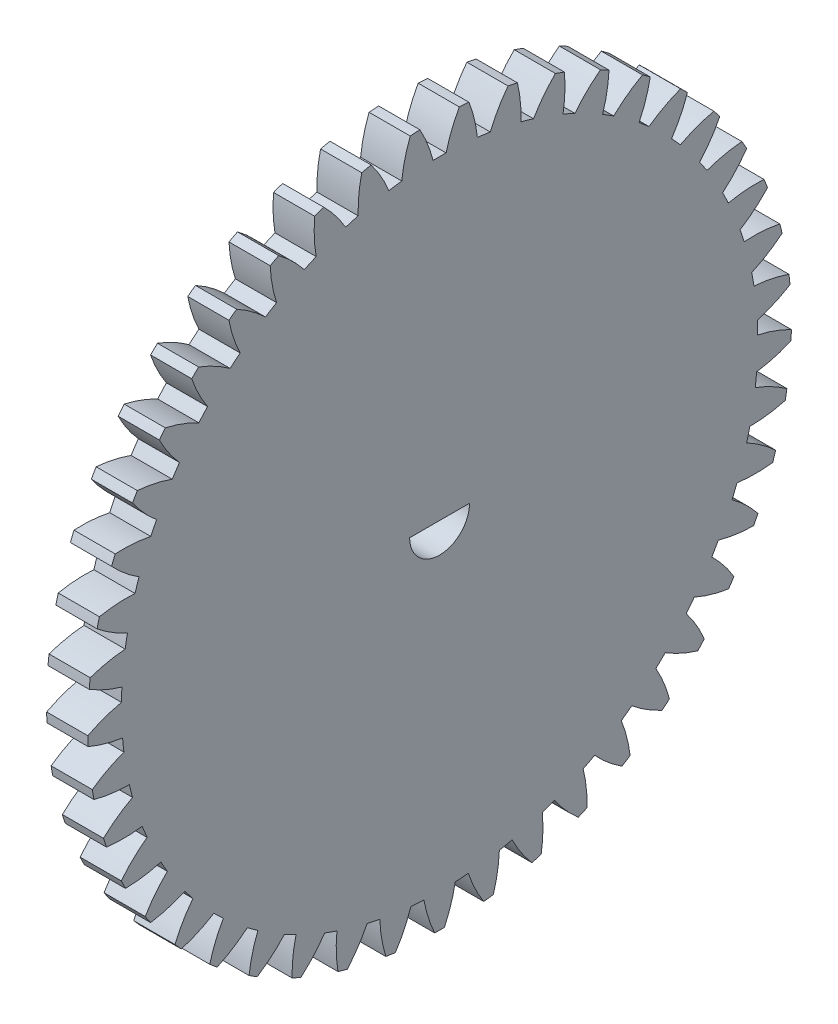
from build123d import *

# Parameters (mm, degrees)
BASPROSKE_W           = 5.5
BASPROSKE_H           = 47
TOOTHCUT_DEPTH        = 67.695202226
TEETHCUTS_COUNT       = 45
TEETHCUTS_ANGLE       = 352
BORSKE_R              = 0.4
BORE_DEPTH            = 50.0000508
CORTAR_EXTRUIR1_DEPTH = 6


with BuildPart() as part:
    # BasProSke → Base-Revolve (revolve)
    with BuildSketch(Plane(origin=(0, 0, 0), x_dir=(1, 0, 0), z_dir=(0, 1, 0))):
        with Locations((2.75, 23.5)):
            Rectangle(BASPROSKE_W, BASPROSKE_H)
    revolve(axis=Axis((-10, 0, 0), (1, 0, 0)))

    # TooCutSke → ToothCut (cut, through all)
    with BuildSketch(Plane(origin=(0, 0, 0), x_dir=(0, 0, -1), z_dir=(1, 0, 0))):
        with BuildLine():
            ThreePointArc((0.870558136, 42.49008272), (0, 42.499), (-0.870558136, 42.49008272))
            ThreePointArc((-0.870558136, 42.49008272), (-1.611306544, 44.779997814), (-2.650928503, 46.950621117))
            ThreePointArc((-2.650928503, 46.950621117), (0, 47.0254), (2.650928503, 46.950621117))
            ThreePointArc((2.650928503, 46.950621117), (1.611306544, 44.779997814), (0.870558136, 42.49008272))
        make_face()
    toothcut = extrude(amount=TOOTHCUT_DEPTH, mode=Mode.SUBTRACT)

    # TeethCuts: ToothCut ×45 about axis
    teethcuts_axis = Axis((-10, 0, 0), (1, 0, 0))
    for i in range(1, TEETHCUTS_COUNT):
        add(toothcut.rotate(teethcuts_axis, i * TEETHCUTS_ANGLE / (TEETHCUTS_COUNT - 1)), mode=Mode.SUBTRACT)

    # BorSke → Bore (cut, symmetric)
    with BuildSketch(Plane(origin=(0, 0, 0), x_dir=(0, 0, -1), z_dir=(1, 0, 0))):
        Circle(BORSKE_R)
    extrude(amount=BORE_DEPTH, both=True, mode=Mode.SUBTRACT)

    # Croquis1 → Cortar-Extruir1 (cut)
    with BuildSketch(Plane(origin=(5.5, 0, 0), x_dir=(0, 0, -1), z_dir=(1, 0, 0))):
        with BuildLine():
            Line((-4, 0.4), (4, 0.4))
            ThreePointArc((4, 0.4), (0, -3.6), (-4, 0.4))
        make_face()
    extrude(amount=-CORTAR_EXTRUIR1_DEPTH, mode=Mode.SUBTRACT)


solid = part.part
